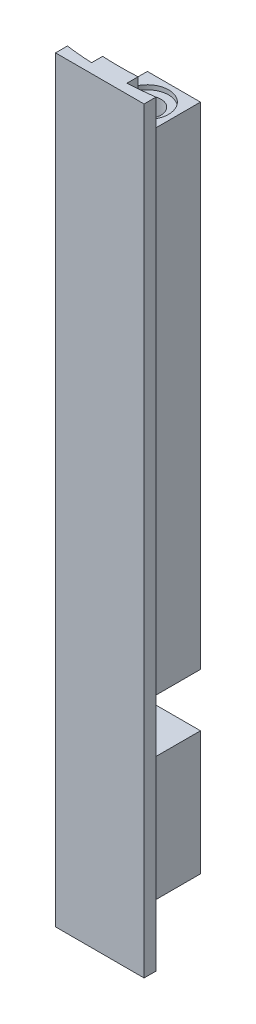
from build123d import *

# Parameters (mm, degrees)
BOSS_EXTRUDE2_DEPTH = 75.5
BOSS_EXTRUDE3_DEPTH = 85.5
SKETCH7_W           = 37.5
SKETCH7_H           = 6
SKETCH9_R           = 1.55
CUT_EXTRUDE4_DEPTH  = 4.3
SKETCH10_R          = 2.4
CUT_EXTRUDE5_DEPTH  = 0.5
SKETCH13_R          = 2.4
CUT_EXTRUDE6_DEPTH  = 0.5
SKETCH14_R          = 1.55
CUT_EXTRUDE7_DEPTH  = 4.3


with BuildPart() as part:
    # Sketch3 → Boss-Extrude2 (new body)
    with BuildSketch(Plane.XZ.offset(5)):
        with BuildLine():
            Line((-3, 37.379807383), (-3, 31.379807383))
            Line((-3, 31.379807383), (3, 31.379807383))
            Line((3, 31.379807383), (3, 37.379807383))
            ThreePointArc((3, 37.379807383), (0, 37.5), (-3, 37.379807383))
        make_face()
    extrude(amount=BOSS_EXTRUDE2_DEPTH)

    # Sketch5 → Boss-Extrude3 (add)
    with BuildSketch(Plane(origin=(0, 0, 0), x_dir=(1, 0, 0), z_dir=(0, 1, 0))):
        with BuildLine():
            Line((-5, -38.409398717), (-5, -39.236412732))
            Line((-5, -39.236412732), (-5, -39.751110463))
            Line((-5, -39.751110463), (0, -39.751110463))
            Line((0, -39.751110463), (5, -39.751110463))
            Line((5, -39.751110463), (5, -39.41427469))
            Line((5, -39.41427469), (5, -38.409398717))
            ThreePointArc((5, -38.409398717), (3.502649729, -38.574776145), (2.00000116, -38.681803282))
            Line((2.00000116, -38.681803282), (2.00000116, -37.431803282))
            ThreePointArc((2.00000116, -37.431803282), (0, -37.485195766), (-2.00000116, -37.431803282))
            Line((-2.00000116, -37.431803282), (-2.00000116, -38.681803282))
            ThreePointArc((-2.00000116, -38.681803282), (-3.502649729, -38.574776145), (-5, -38.409398717))
        make_face()
    extrude(amount=-BOSS_EXTRUDE3_DEPTH)

    # Sketch7 → Cut-Revolve1 (revolve, cut)
    with BuildSketch(Plane(origin=(0, 0, 0), x_dir=(0, 0, -1), z_dir=(1, 0, 0))):
        with Locations((-18.75, -63.5)):
            Rectangle(SKETCH7_W, SKETCH7_H)
    revolve(axis=Axis((0, -27.016689378, 0), (0, -1, 0)), mode=Mode.SUBTRACT)

    # Sketch9 → Cut-Extrude4 (cut)
    with BuildSketch(Plane(origin=(0, -80.5, 0), x_dir=(-1, 0, 0), z_dir=(0, -1, 0))):
        with Locations((0, -34.420864201)):
            Circle(SKETCH9_R)
    extrude(amount=-CUT_EXTRUDE4_DEPTH, mode=Mode.SUBTRACT)

    # Sketch10 → Cut-Extrude5 (cut)
    with BuildSketch(Plane(origin=(0, -80.5, 0), x_dir=(-1, 0, 0), z_dir=(0, -1, 0))):
        with Locations((0, -34.420864201)):
            Circle(SKETCH10_R)
    extrude(amount=-CUT_EXTRUDE5_DEPTH, mode=Mode.SUBTRACT)

    # Sketch13 → Cut-Extrude6 (cut)
    with BuildSketch(Plane(origin=(0, -5, 0), x_dir=(-1, 0, 0), z_dir=(0, -1, 0))):
        with Locations((0, -34.379807383)):
            Circle(SKETCH13_R)
    extrude(amount=CUT_EXTRUDE6_DEPTH, mode=Mode.SUBTRACT)

    # Sketch14 → Cut-Extrude7 (cut)
    with BuildSketch(Plane(origin=(0, -5, 0), x_dir=(-1, 0, 0), z_dir=(0, -1, 0))):
        with Locations((0, -34.379807383)):
            Circle(SKETCH14_R)
    extrude(amount=CUT_EXTRUDE7_DEPTH, mode=Mode.SUBTRACT)


solid = part.part
